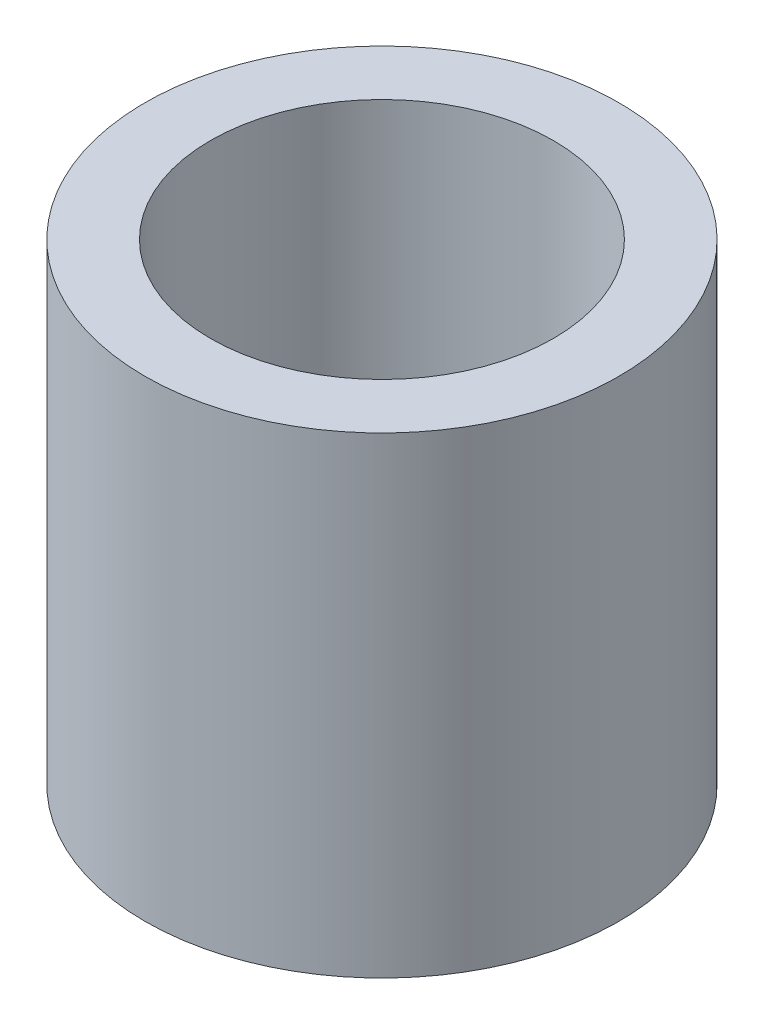
from build123d import *

# Parameters (mm, degrees)
SKETCH1_R           = 12.3
BOSS_EXTRUDE1_DEPTH = 24.5
SKETCH2_R           = 8.9
CUT_EXTRUDE1_DEPTH  = 20
SKETCH3_R           = 5.5
CUT_EXTRUDE2_DEPTH  = 1
CUT_EXTRUDE3_REACH  = 29.269
SKETCH4_R           = 4.3


with BuildPart() as part:
    # Sketch1 → Boss-Extrude1 (new body)
    with BuildSketch(Plane(origin=(0, 0, 0), x_dir=(1, 0, 0), z_dir=(0, 1, 0))):
        Circle(SKETCH1_R)
    extrude(amount=BOSS_EXTRUDE1_DEPTH)

    # Sketch2 → Cut-Extrude1 (cut)
    with BuildSketch(Plane(origin=(0, 24.5, 0), x_dir=(1, 0, 0), z_dir=(0, 1, 0))):
        Circle(SKETCH2_R)
    extrude(amount=-CUT_EXTRUDE1_DEPTH, mode=Mode.SUBTRACT)

    # Sketch3 → Cut-Extrude2 (cut)
    with BuildSketch(Plane(origin=(0, 4.5, 0), x_dir=(1, 0, 0), z_dir=(0, 1, 0))):
        Circle(SKETCH3_R)
    extrude(amount=-CUT_EXTRUDE2_DEPTH, mode=Mode.SUBTRACT)

    # Sketch4 → Cut-Extrude3 (cut, up to next)
    with BuildSketch(Plane(origin=(0, 3.5, 0), x_dir=(1, 0, 0), z_dir=(0, 1, 0)), mode=Mode.PRIVATE) as cut_extrude3_sk1:
        Circle(SKETCH4_R)
    cut_extrude3_tool1 = extrude(cut_extrude3_sk1.sketch, amount=-CUT_EXTRUDE3_REACH, mode=Mode.PRIVATE) & part.part
    add(cut_extrude3_tool1.solids().sort_by_distance((0, 3.5, 0))[0], mode=Mode.SUBTRACT)


solid = part.part
